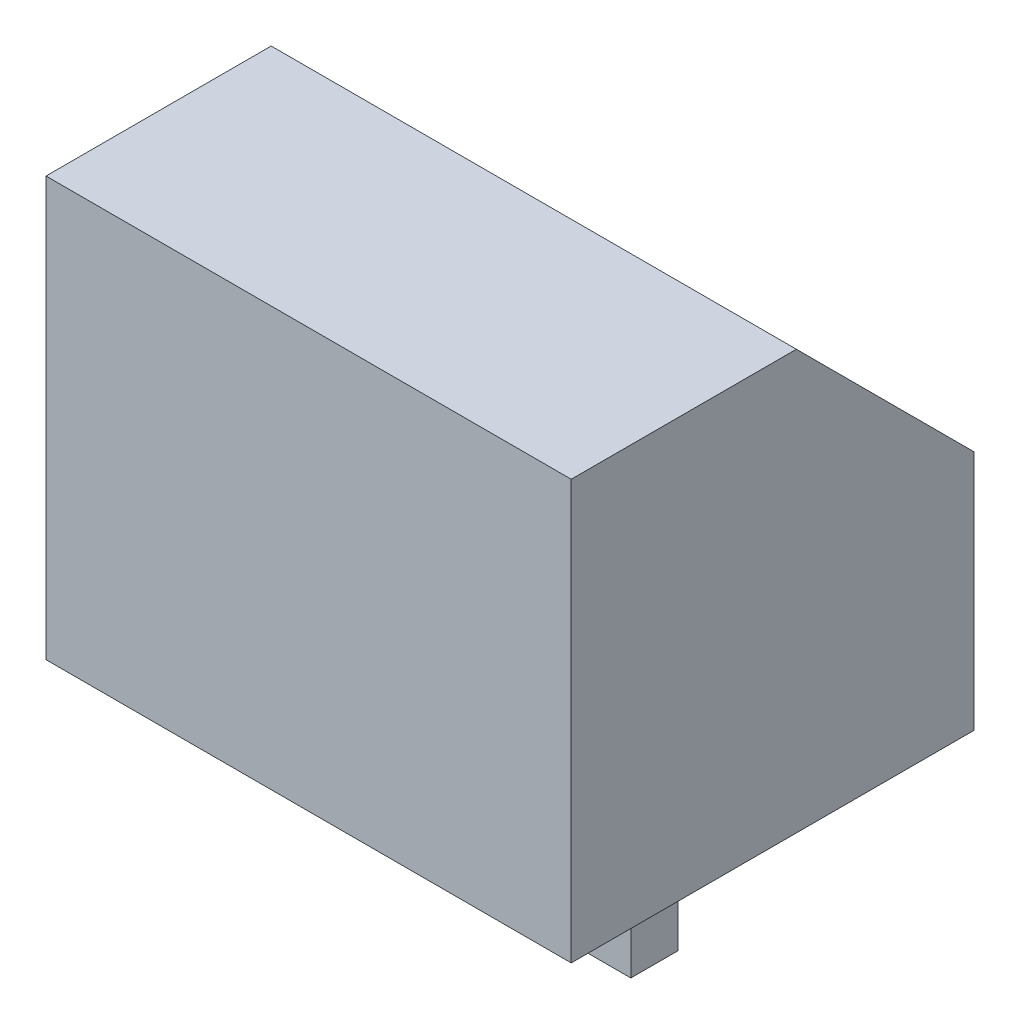
from build123d import *

# Parameters (mm, degrees)
SKETCH1_W           = 20.701
SKETCH1_H           = 15.875
BOSS_EXTRUDE1_DEPTH = 16.51
SKETCH2_W           = 1.8542
SKETCH2_H           = 1.8542
BOSS_EXTRUDE2_DEPTH = 6.35
CHAMFER1_SIZE       = 7


with BuildPart() as part:
    # Sketch1 → Boss-Extrude1 (new body)
    with BuildSketch(Plane(origin=(0, 0, 0), x_dir=(1, 0, 0), z_dir=(0, 1, 0))):
        Rectangle(SKETCH1_W, SKETCH1_H)
    extrude(amount=BOSS_EXTRUDE1_DEPTH)

    # Sketch2 → Boss-Extrude2 (add)
    with BuildSketch(Plane(origin=(0, 0, 0), x_dir=(-1, 0, 0), z_dir=(0, -1, 0))):
        with Locations((4.7625, 0)):
            Rectangle(SKETCH2_W, SKETCH2_H)
        with Locations((-4.7625, 0)):
            Rectangle(SKETCH2_W, SKETCH2_H)
    extrude(amount=BOSS_EXTRUDE2_DEPTH)

    # Chamfer1
    chamfer1_edges = [part.edges().sort_by_distance(p)[0] for p in [
        (0, 16.51, -7.9375),
    ]]
    chamfer(chamfer1_edges, length=CHAMFER1_SIZE)


solid = part.part
